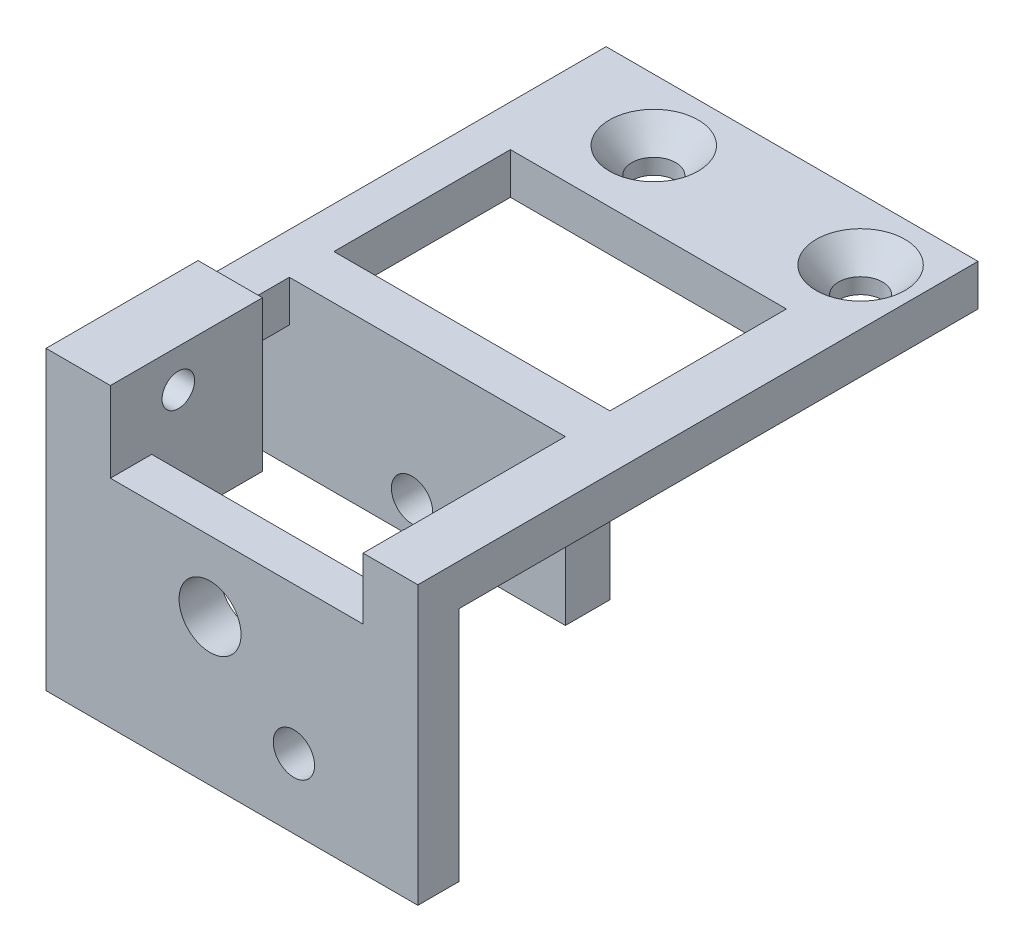
from build123d import *

# Parameters (mm, degrees)
SKETCH1_R                                        = 3.175
SKETCH1_R_2                                      = 4.762499999
BOSS_EXTRUDE1_DEPTH                              = 6.35
BOSS_EXTRUDE2_DEPTH                              = 23.368
SKETCH3_W                                        = 6.35
SKETCH3_H                                        = 78.34
SKETCH3_W_2                                      = 8.382
BOSS_EXTRUDE3_DEPTH                              = 6.35
CUT_EXTRUDE1_REACH                               = 104.101
SKETCH4_R                                        = 2.5
BOSS_EXTRUDE4_DEPTH                              = 6.35
CSK_FOR_1_4_FLAT_HEAD_MACHINE_SCREW1_D           = 6.7564
CSK_FOR_1_4_FLAT_HEAD_MACHINE_SCREW1_CSINK_D     = 13.6398
CSK_FOR_1_4_FLAT_HEAD_MACHINE_SCREW1_CSINK_ANGLE = 82
SKETCH8_W                                        = 48.768
SKETCH8_H                                        = 6.843039895
BOSS_EXTRUDE5_DEPTH                              = 25.146
CUT_EXTRUDE2_REACH                               = 68.059
SKETCH10_R                                       = 3.175


with BuildPart() as part:
    # Sketch1 → Boss-Extrude1 (new body)
    with BuildSketch(Plane.XY):
        Polygon((23.52260518, 29.069744957), (31.942128684, 29.069744957), (31.942128684, -13.602255043), (-25.207871316, -13.602255043), (-25.207871316, 8.844196721), (-25.207871316, 31.958196721), (-18.857871316, 31.958196721), (-15.310946905, 31.958196721), (-15.310946905, 22.656471706), (-15.310946905, 19.620299994), (23.52260518, 19.620299994), (23.52260518, 22.656471706), align=None)
        with Locations((12.892128684, -2.934255043)):
            Circle(SKETCH1_R, mode=Mode.SUBTRACT)
        with Locations((6.7e-08, 8.844196721)):
            Circle(SKETCH1_R_2, mode=Mode.SUBTRACT)
    extrude(amount=-BOSS_EXTRUDE1_DEPTH)

    # Sketch2 → Boss-Extrude2 (add)
    with BuildSketch(Plane.XY):
        Polygon((-15.310946905, 31.958196721), (-18.857871316, 31.958196721), (-25.207871316, 31.958196721), (-25.207871316, 8.844196721), (-18.857871316, 8.844196721), (-15.310946905, 8.844196721), (-15.310946905, 19.620299994), align=None)
    extrude(amount=-BOSS_EXTRUDE2_DEPTH)

    # Sketch3 → Boss-Extrude3 (add)
    with BuildSketch(Plane(origin=(0, 29.069744957, 0), x_dir=(1, 0, 0), z_dir=(0, 1, 0))):
        with Locations((-22.032871316, 39.17)):
            Rectangle(SKETCH3_W, SKETCH3_H)
        with Locations((27.751128684, 39.17)):
            Rectangle(SKETCH3_W_2, SKETCH3_H)
    extrude(amount=-BOSS_EXTRUDE3_DEPTH)

    # Sketch4 → Cut-Extrude1 (cut, up to next)
    with BuildSketch(Plane.ZY.offset(25.207871316), mode=Mode.PRIVATE) as cut_extrude1_sk1:
        with Locations((-10.437499124, 26.162307082)):
            Circle(SKETCH4_R)
    cut_extrude1_tool1 = extrude(cut_extrude1_sk1.sketch, amount=-CUT_EXTRUDE1_REACH, mode=Mode.PRIVATE) & part.part
    add(cut_extrude1_tool1.solids().sort_by_distance((-25.207871, 26.162307, -10.437499))[0], mode=Mode.SUBTRACT)

    # Sketch5 → Boss-Extrude4 (add)
    with BuildSketch(Plane(origin=(0, 29.069744957, 0), x_dir=(1, 0, 0), z_dir=(0, 1, 0))):
        Polygon((-25.207871316, 78.34), (-25.207871316, 65.022649662), (31.942128684, 65.022649662), (31.942128684, 78.34), (31.942128684, 86.081334737), (-25.207871316, 86.081334737), align=None)
    extrude(amount=-BOSS_EXTRUDE4_DEPTH)

    # CSK for 1/4 Flat Head Machine Screw1 (through all)
    with Locations(Plane(origin=(0, 29.069744957, 0), x_dir=(1, 0, 0), z_dir=(0, 1, 0))):
        with Locations((-8.384740386, 76.584176364), (23.394249394, 76.584176364)):
            CounterSinkHole(CSK_FOR_1_4_FLAT_HEAD_MACHINE_SCREW1_D / 2, CSK_FOR_1_4_FLAT_HEAD_MACHINE_SCREW1_CSINK_D / 2, counter_sink_angle=CSK_FOR_1_4_FLAT_HEAD_MACHINE_SCREW1_CSINK_ANGLE)

    # Sketch8 → Boss-Extrude5 (add)
    with BuildSketch(Plane(origin=(0, 29.069744957, 0), x_dir=(1, 0, 0), z_dir=(0, 1, 0))):
        with Locations((-0.823871316, 34.471519947)):
            Rectangle(SKETCH8_W, SKETCH8_H)
    extrude(amount=-BOSS_EXTRUDE5_DEPTH)

    # Sketch10 → Cut-Extrude2 (cut, up to next)
    with BuildSketch(Plane(origin=(0, 0, -37.893039895), x_dir=(-1, 0, 0), z_dir=(0, 0, -1)), mode=Mode.PRIVATE) as cut_extrude2_sk1:
        with Locations((-6.7e-08, 8.844196721)):
            Circle(SKETCH10_R)
    cut_extrude2_tool1 = extrude(cut_extrude2_sk1.sketch, amount=-CUT_EXTRUDE2_REACH, mode=Mode.PRIVATE) & part.part
    add(cut_extrude2_tool1.solids().sort_by_distance((0, 8.844197, -37.89304))[0], mode=Mode.SUBTRACT)


solid = part.part
